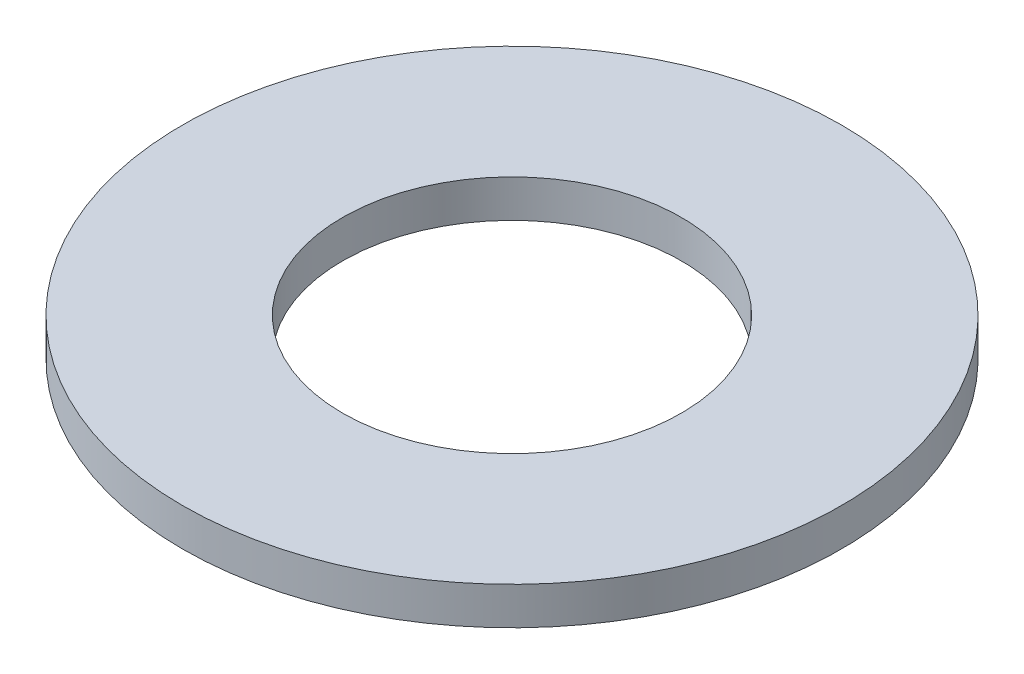
from build123d import *

# Parameters (mm, degrees)
SKETCH1_R           = 87.5
BOSS_EXTRUDE1_DEPTH = 10
SKETCH2_R           = 45
CUT_EXTRUDE1_DEPTH  = 125.147090179


with BuildPart() as part:
    # Sketch1 → Boss-Extrude1 (new body)
    with BuildSketch(Plane(origin=(0, 0, 0), x_dir=(1, 0, 0), z_dir=(0, 1, 0))):
        Circle(SKETCH1_R)
    extrude(amount=BOSS_EXTRUDE1_DEPTH)

    # Sketch2 → Cut-Extrude1 (cut, through all)
    with BuildSketch(Plane(origin=(0, 0, 0), x_dir=(1, 0, 0), z_dir=(0, 1, 0))):
        Circle(SKETCH2_R)
    extrude(amount=CUT_EXTRUDE1_DEPTH, mode=Mode.SUBTRACT)


solid = part.part
